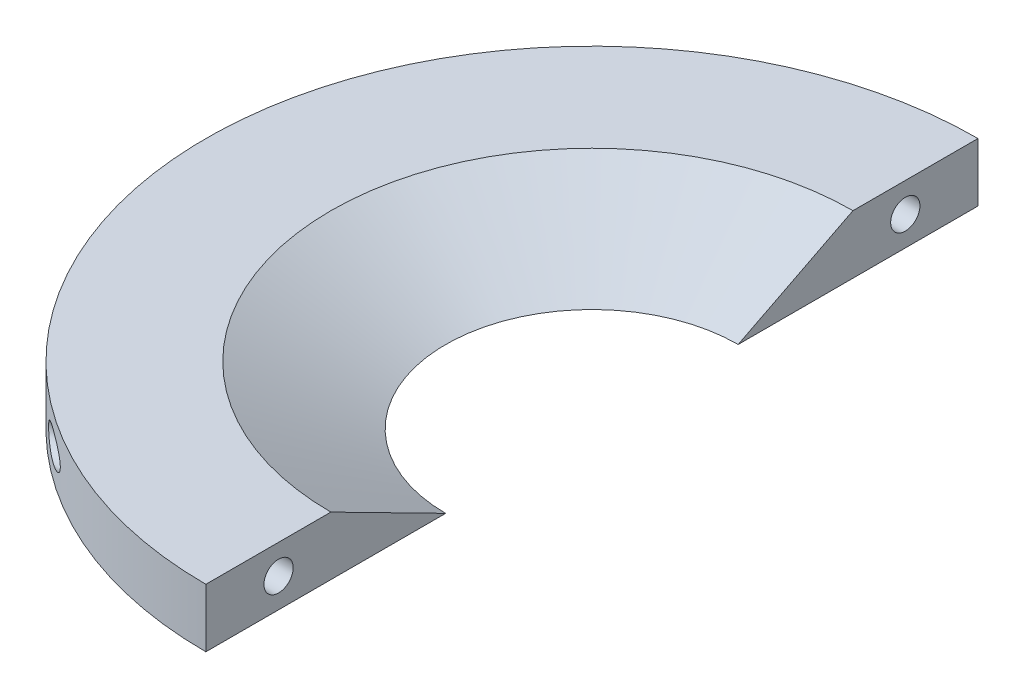
from build123d import *

# Parameters (mm, degrees)
STOCK_NOS_TANK_PLATE_SUPPORT_VALVE_1_ANGLE = 180
SKETCH4_R                                  = 3.175
CUT_EXTRUDE2_DEPTH                         = 60.198


# Read off the part's stored shape, not the designer's step: Stock-Nos Tank Plate Support Valve-1
with BuildPart() as part:
    # Stock-Nos Tank Plate Support Valve-1 out → Stock-Nos Tank Plate Support Valve-1 (revolve)
    with BuildSketch(Plane(origin=(0, 0, 0), x_dir=(0, 0, -1), z_dir=(1, 0, 0))):
        Polygon((83.82, 6.35), (56.67515342, 6.35), (31.75, -6.35), (83.82, -6.35), align=None)
    revolve(axis=Axis((0, 0, 0), (0, 1, 0)), revolution_arc=STOCK_NOS_TANK_PLATE_SUPPORT_VALVE_1_ANGLE)

    # Sketch4 → Cut-Extrude2 (cut)
    with BuildSketch(Plane(origin=(0, 0, 0), x_dir=(0, 0, -1), z_dir=(1, 0, 0))):
        with Locations((-68.035369102, 0)):
            Circle(SKETCH4_R)
    cut_extrude2 = extrude(amount=-CUT_EXTRUDE2_DEPTH, mode=Mode.SUBTRACT)

    # Mirror1: Cut-Extrude2 across plane
    add(cut_extrude2.mirror(Plane.XY), mode=Mode.SUBTRACT)


solid = part.part
